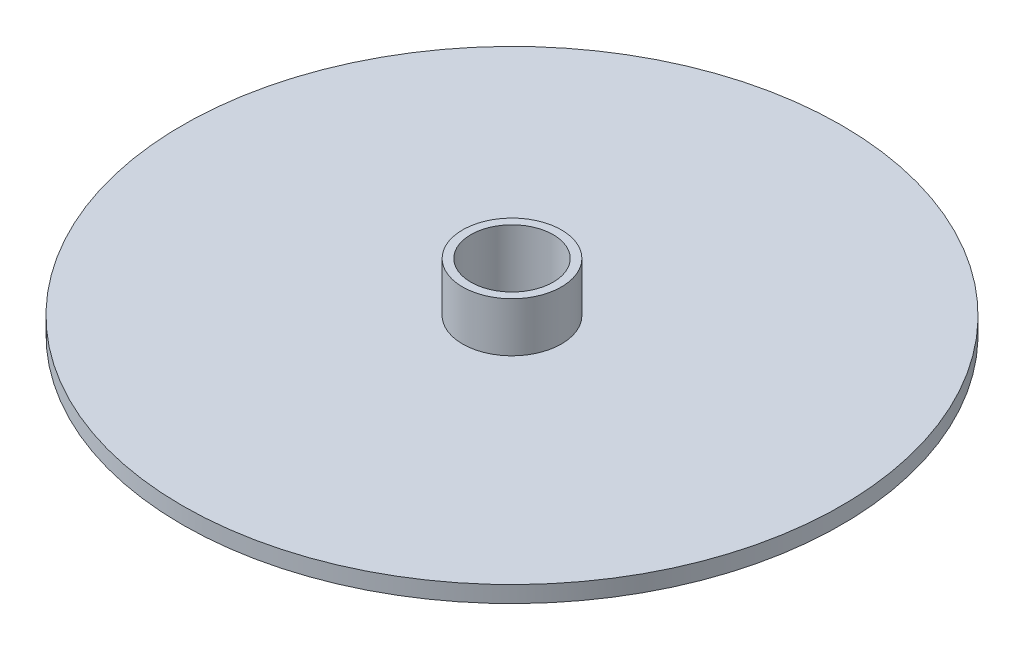
from build123d import *

# Parameters (mm, degrees)
SKETCH1_R           = 1000
BOSS_EXTRUDE1_DEPTH = 50
SKETCH4_R           = 125
CUT_EXTRUDE5_DEPTH  = 50
BOSS_EXTRUDE2_START = 150
SKETCH5_R           = 150
SKETCH5_R_2         = 125
BOSS_EXTRUDE2_DEPTH = 150


with BuildPart() as part:
    # Sketch1 → Boss-Extrude1 (new body)
    with BuildSketch(Plane(origin=(0, 0, 0), x_dir=(1, 0, 0), z_dir=(0, 1, 0))):
        Circle(SKETCH1_R)
    extrude(amount=BOSS_EXTRUDE1_DEPTH)

    # Sketch4 → Cut-Extrude5 (cut)
    with BuildSketch(Plane(origin=(0, 50, 0), x_dir=(1, 0, 0), z_dir=(0, 1, 0))):
        Circle(SKETCH4_R)
    extrude(amount=-CUT_EXTRUDE5_DEPTH, mode=Mode.SUBTRACT)

    # Sketch5 → Boss-Extrude2 (add)
    with BuildSketch(Plane(origin=(0, 50, 0), x_dir=(1, 0, 0), z_dir=(0, 1, 0)).offset(BOSS_EXTRUDE2_START)):
        Circle(SKETCH5_R)
        Circle(SKETCH5_R_2, mode=Mode.SUBTRACT)
    extrude(amount=-BOSS_EXTRUDE2_DEPTH)


solid = part.part
